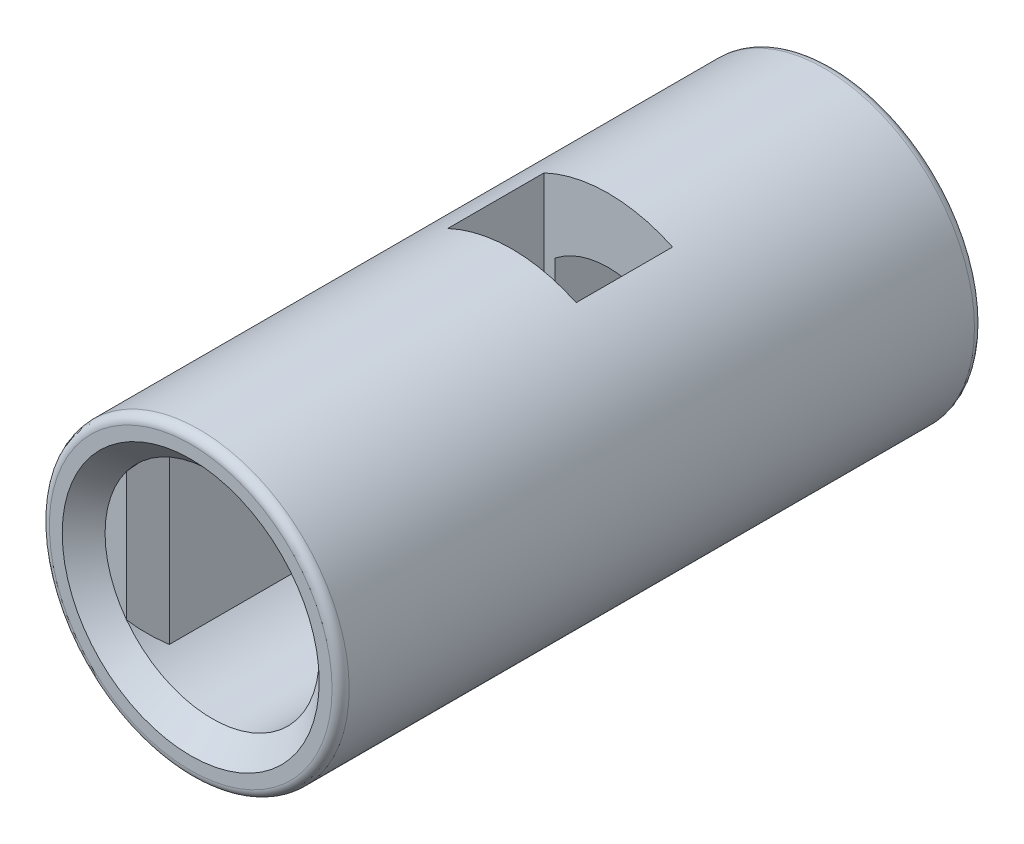
from build123d import *
from build123d.topology import SkipClean

# Parameters (mm, degrees)
EXTRUDE_1_DEPTH                 = 7.5
EXTRUDE_1_DEPTH_BACK            = 7.5
SKETCH_1_R                      = 3.5
CUT_EXTRUDE_1_REACH             = 10.986
CUT_EXTRUDE_1_DIRECTION_2_REACH = 10.986
FILLET_1_R                      = 0.2
SKETCH_3_R                      = 2.5
CUT_EXTRUDE_2_DEPTH             = 0.5
CUT_EXTRUDE_3_DEPTH             = 7
CHAMFER_1_SIZE                  = 0.5
CHAMFER_2_SIZE                  = 0.5


with BuildPart() as part:
    # 草图1 → 凸台-拉伸1 (new, two sides: drawn at the far end of the back side and taken through both)
    with BuildSketch(Plane.XY.offset(-EXTRUDE_1_DEPTH_BACK)):
        Circle(SKETCH_1_R)
        with BuildLine():
            Line((-1.25, 1.5612495), (-1.25, -1.5612495))
            ThreePointArc((-1.25, -1.5612495), (0, -2), (1.25, -1.5612495))
            Line((1.25, -1.5612495), (1.25, 1.5612495))
            ThreePointArc((1.25, 1.5612495), (0, 2), (-1.25, 1.5612495))
        make_face(mode=Mode.SUBTRACT)
    extrude(amount=EXTRUDE_1_DEPTH + EXTRUDE_1_DEPTH_BACK)

    # 草图2 → 切除-拉伸1 (cut, up to next)
    with BuildSketch(Plane(origin=(0, 0, 0), x_dir=(1, 0, 0), z_dir=(0, 1, 0)), mode=Mode.PRIVATE) as cut_extrude_1_sk1:
        Polygon((0, 0), (-1.5, 0), (-1.5, 2.25), (1.5, 2.25), (1.5, 0), align=None)
    cut_extrude_1_tool1 = extrude(cut_extrude_1_sk1.sketch, amount=-CUT_EXTRUDE_1_REACH, mode=Mode.PRIVATE) & part.part
    add(cut_extrude_1_tool1.solids().sort_by_distance((0, 0, -1.125))[0], mode=Mode.SUBTRACT)

    # 草图2 → 切除-拉伸1 direction 2 (cut, up to next)
    with BuildSketch(Plane(origin=(0, 0, 0), x_dir=(1, 0, 0), z_dir=(0, 1, 0)), mode=Mode.PRIVATE) as cut_extrude_1_direction_2_sk1:
        Polygon((0, 0), (-1.5, 0), (-1.5, 2.25), (1.5, 2.25), (1.5, 0), align=None)
    cut_extrude_1_direction_2_tool1 = extrude(cut_extrude_1_direction_2_sk1.sketch, amount=CUT_EXTRUDE_1_DIRECTION_2_REACH, mode=Mode.PRIVATE) & part.part
    add(cut_extrude_1_direction_2_tool1.solids().sort_by_distance((0, 0, -1.125))[0], mode=Mode.SUBTRACT)

    # 圆角1
    fillet_1_edges = [part.edges().sort_by_distance(p)[0] for p in [
        (-3.5, 0, -7.5),
        (-3.5, 0, 7.5),
    ]]
    fillet(fillet_1_edges, radius=FILLET_1_R)

    # 草图3 → 切除-拉伸2 (cut)
    with BuildSketch(Plane.XY.offset(7.5)):
        Circle(SKETCH_3_R)
    extrude(amount=-CUT_EXTRUDE_2_DEPTH, mode=Mode.SUBTRACT)

    # 草图4 → 切除-拉伸3 (cut)
    with SkipClean():  # the faces are left unmerged after this step: merging them gives an invalid solid
        with BuildSketch(Plane.XY.offset(7)):
            with BuildLine():
                Line((-1.5, 0), (-1.5, 2))
                ThreePointArc((-1.5, 2), (2.5, 0), (-1.5, -2))
                Line((-1.5, -2), (-1.5, 0))
            make_face()
        extrude(amount=-CUT_EXTRUDE_3_DEPTH, mode=Mode.SUBTRACT)

    # 倒角1
    # the kernel refuses this chamfer: 0.5 mm, written as the material it takes off along each edge
    with BuildSketch(Plane(origin=(0, 0, 7.5), x_dir=(1, 0, 0), z_dir=(0, -1, 0))) as chamfer_1_piece_1_section:
        Polygon((2.5 + CHAMFER_1_SIZE, 0), (2.5, -CHAMFER_1_SIZE), (2.5, 0), align=None)
    chamfer_1_piece_1 = revolve(axis=Axis((0, 0, 7.5), (0, 0, 1)), mode=Mode.PRIVATE)
    chamfer_1_piece_1 = split(chamfer_1_piece_1, bisect_by=Plane(origin=(-1.5, 2.458621217, 7.265320049), z_dir=(1, 0, 0)), keep=Keep.TOP, mode=Mode.PRIVATE)
    chamfer_1_piece_1 = split(chamfer_1_piece_1, bisect_by=Plane(origin=(1.229310608, 2.458621217, 7), z_dir=(0, 0, 1)), keep=Keep.TOP, mode=Mode.PRIVATE)
    add(chamfer_1_piece_1, mode=Mode.SUBTRACT)
    with BuildSketch(Plane(origin=(0, 0, 7.5), x_dir=(1, 0, 0), z_dir=(0, -1, 0))) as chamfer_1_piece_2_section:
        Polygon((2.5 + CHAMFER_1_SIZE, 0), (2.5, -CHAMFER_1_SIZE), (2.5, 0), align=None)
    chamfer_1_piece_2 = revolve(axis=Axis((0, 0, 7.5), (0, 0, 1)), mode=Mode.PRIVATE)
    chamfer_1_piece_2 = split(chamfer_1_piece_2, bisect_by=Plane(origin=(-1.5, 0, 7.263385129), z_dir=(-1, 0, 0)), keep=Keep.TOP, mode=Mode.PRIVATE)
    chamfer_1_piece_2 = split(chamfer_1_piece_2, bisect_by=Plane(origin=(-2.750757007, 0, 7), z_dir=(0, 0, 1)), keep=Keep.TOP, mode=Mode.PRIVATE)
    add(chamfer_1_piece_2, mode=Mode.SUBTRACT)
    with BuildSketch(Plane(origin=(-1.5, -3.285841494, 7), x_dir=(0.02749587661058651, 0, -0.9996219169112968), z_dir=(0, 1, 0))) as chamfer_1_piece_3_section:
        Polygon((CHAMFER_1_SIZE * 0.999621916911, CHAMFER_1_SIZE * 0.0274958766106), (-CHAMFER_1_SIZE * 0.0274958766106, CHAMFER_1_SIZE * 0.999621916911), (0, 0), align=None)
    chamfer_1_piece_3 = extrude(amount=6.571682988, mode=Mode.PRIVATE)
    chamfer_1_piece_3 = chamfer_1_piece_3 & Plane(origin=(0, 0, 6.830829646), x_dir=(-0.5999999999999999, 0.8, 0), z_dir=(0, 0, 1)) * Cylinder(2.5, 16, mode=Mode.PRIVATE)
    add(chamfer_1_piece_3, mode=Mode.SUBTRACT)

    # 倒角2
    chamfer_2_edges = [part.edges().sort_by_distance(p)[0] for p in [
        (-1.25, 0, -7.5),
        (0, -2, -7.5),
        (1.25, 0, -7.5),
        (0, 2, -7.5),
    ]]
    chamfer(chamfer_2_edges, length=CHAMFER_2_SIZE)


solid = part.part
